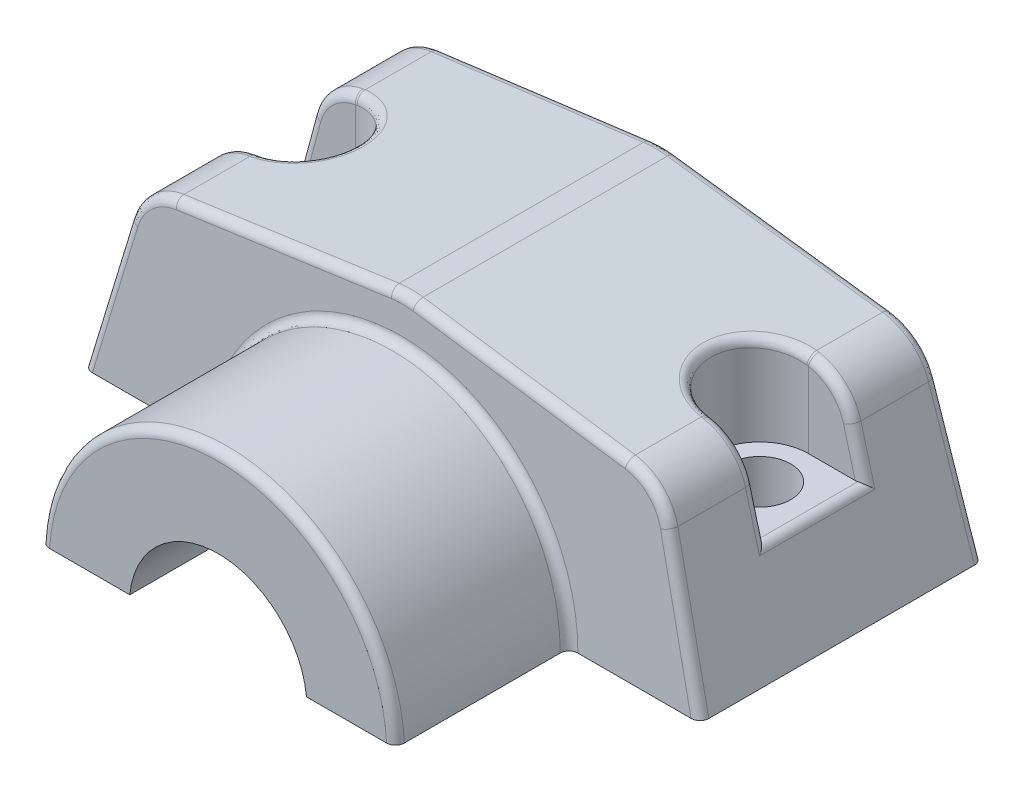
from build123d import *

# Parameters (mm, degrees)
CYLINDRE_DEPTH      = 50
FORME_DEPTH         = 32
D_POUILLES_ANGLE    = -3
CONG_S_R6_R         = 6
LAMAGE_REACH        = 64.402
ESQUISSE_TROU_R     = 3.5
TROU_DEPTH          = 63.401923047
CONG_R10_R          = 10
CONG_S_R1_R         = 1
ESQUISSE_AL_SAGE_R  = 10
AL_SAGE_DEPTH       = 49
ESQUISSE_FRAISAGE_W = 72
ESQUISSE_FRAISAGE_H = 3
FRAISAGE_DEPTH      = 68.064473799


with BuildPart() as part:
    # Esquisse cylindre → Cylindre (new body)
    with BuildSketch(Plane.XY):
        with BuildLine():
            Line((-20, 0), (20, 0))
            ThreePointArc((20, 0), (0, 20), (-20, 0))
        make_face()
    extrude(amount=CYLINDRE_DEPTH)

    # Esquisse forme → Forme (add)
    with BuildSketch(Plane(origin=(0, 0, -1.5), x_dir=(-1, 0, 0), z_dir=(0, 0, -1))):
        Polygon((-35, 0), (35, 0), (29.373066959, 21), (0, 25), (-29.373066959, 21), align=None)
    extrude(amount=-FORME_DEPTH)

    # Dépouilles
    d_pouilles_faces = [part.faces().sort_by_distance(p)[0] for p in [
        (0, 11.164757272, -1.5),
        (31.468557493, 10.307618914, 30.5),
    ]]
    draft(d_pouilles_faces, Plane(origin=(-20, 0, 50), x_dir=(0, 0, -1), z_dir=(0, -1, 0)), D_POUILLES_ANGLE)

    # Congés R6
    cong_s_r6_edges = [part.edges().sort_by_distance(p)[0] for p in [
        (-29.373066959, 21, 14.5),
        (29.373066959, 21, 14.5),
    ]]
    fillet(cong_s_r6_edges, radius=CONG_S_R6_R)

    # Esquisse lamage → Lamage (cut, up to next)
    with BuildSketch(Plane.XZ.offset(-12), mode=Mode.PRIVATE) as lamage_sk1:
        with BuildLine():
            Line((25.5, 20), (34, 20))
            Line((34, 20), (34, 9))
            Line((34, 9), (25.5, 9))
            ThreePointArc((25.5, 9), (20, 14.5), (25.5, 20))
        make_face()
    lamage_tool1 = extrude(lamage_sk1.sketch, amount=-LAMAGE_REACH, mode=Mode.PRIVATE) & part.part
    lamage = lamage_tool1.solids().sort_by_distance((27.53138, 12, 14.5))[0]
    add(lamage, mode=Mode.SUBTRACT)

    # Esquisse trou → Trou (cut, through all)
    with BuildSketch(Plane(origin=(0, 12, 0), x_dir=(-1, 0, 0), z_dir=(0, 1, 0))):
        with Locations((-25.5, 14.5)):
            Circle(ESQUISSE_TROU_R)
    trou = extrude(amount=-TROU_DEPTH, mode=Mode.SUBTRACT)

    # Symétrie trou: Lamage, Trou across plane
    add(lamage.mirror(Plane(origin=(0, 0, 0), x_dir=(0, 0, 1), z_dir=(1, 0, 0))), mode=Mode.SUBTRACT)
    add(trou.mirror(Plane(origin=(0, 0, 0), x_dir=(0, 0, 1), z_dir=(1, 0, 0))), mode=Mode.SUBTRACT)

    # Congé R10
    cong_r10_edges = [part.edges().sort_by_distance(p)[0] for p in [
        (0, 25, 14.5),
    ]]
    fillet(cong_r10_edges, radius=CONG_R10_R)

    # Congés R1
    cong_s_r1_edges = [part.edges().sort_by_distance(p)[0] for p in [
        (32.702852046, 8.573072875, 30.050704289),
        (28.577183399, 20.094635611, 29.446884772),
        (-28.606568448, 20.06856752, 20),
        (-28.606568448, 20.06856752, 9),
        (-25.459894201, 21.532754468, 19.999853773),
        (-25.459894201, 21.532754468, 9.000146227),
        (0, 20, 50),
        (0, 20, 29.451844414),
        (-13.384544679, 23.17730376, 29.28532898),
        (13.384544679, 23.17730376, 29.28532898),
        (-28.577183399, 20.094635611, 29.446884772),
        (-32.702852046, 8.573072875, 30.050704289),
        (-31.784609691, 12, 14.5),
        (-31.095156892, 14.573072875, 20),
        (-31.095156892, 14.573072875, 9),
        (-20, 22.276416517, 14.5),
        (0, 24.907702108, 29.194642645),
        (31.095156892, 14.573072875, 20),
        (28.606568448, 20.06856752, 20),
        (25.459894201, 21.532754468, 19.999853773),
        (20, 22.276416517, 14.5),
        (25.459894201, 21.532754468, 9.000146227),
        (28.606568448, 20.06856752, 9),
        (31.784609691, 12, 14.5),
        (31.095156892, 14.573072875, 9),
        (32.702852046, 8.573072875, -1.050704289),
        (28.577183399, 20.094635611, -0.446884772),
        (13.384544679, 23.17730376, -0.28532898),
        (0, 24.907702108, -0.194642645),
        (-13.384544679, 23.17730376, -0.28532898),
        (-28.577183399, 20.094635611, -0.446884772),
        (-32.702852046, 8.573072875, -1.050704289),
    ]]
    fillet(cong_s_r1_edges, radius=CONG_S_R1_R)

    # Esquisse alésage → Alésage (cut)
    with BuildSketch(Plane.XY.offset(50)):
        Circle(ESQUISSE_AL_SAGE_R)
    extrude(amount=-AL_SAGE_DEPTH, mode=Mode.SUBTRACT)

    # Esquisse fraisage → Fraisage (cut, through all)
    with BuildSketch(Plane.XY.offset(50)):
        with Locations((0, -0.5)):
            Rectangle(ESQUISSE_FRAISAGE_W, ESQUISSE_FRAISAGE_H)
    extrude(amount=-FRAISAGE_DEPTH, mode=Mode.SUBTRACT)


solid = part.part
